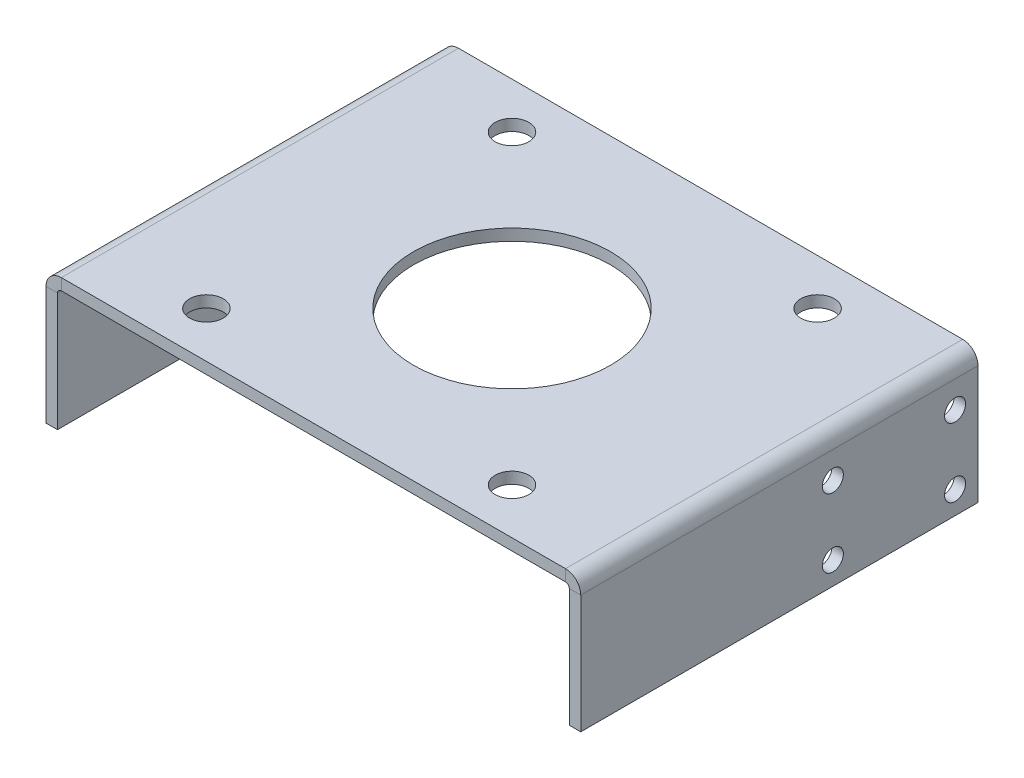
from build123d import *

# Parameters (mm, degrees)
SM_BASE_FLANGE_1_DEPTH = 104
SKETCH_7_R             = 2.75
CUT_EXTRUDE_3_DEPTH    = 3
SKETCH_8_R             = 25.78
CUT_EXTRUDE_4_DEPTH    = 3
SKETCH_9_R             = 4.4
CUT_EXTRUDE_5_DEPTH    = 3


# Sheet-metal steps are written as plain solids
with BuildPart() as part:
    # Sketch 1 → 基体-法兰1 (new body)
    with BuildSketch(Plane.XY):
        with BuildLine():
            Line((-70, -35), (-70, -4))
            ThreePointArc((-70, -4), (-68.828427125, -1.171572875), (-66, 0))
            Line((-66, 0), (66, 0))
            ThreePointArc((66, 0), (68.828427125, -1.171572875), (70, -4))
            Line((70, -4), (70, -35))
            Line((70, -35), (67, -35))
            Line((67, -35), (67, -4))
            ThreePointArc((67, -4), (66.707106781, -3.292893219), (66, -3))
            Line((66, -3), (-66, -3))
            ThreePointArc((-66, -3), (-66.707106781, -3.292893219), (-67, -4))
            Line((-67, -4), (-67, -35))
            Line((-67, -35), (-70, -35))
        make_face()
    extrude(amount=SM_BASE_FLANGE_1_DEPTH)

    # 草图7 → 切除-拉伸3 (cut)
    with BuildSketch(Plane.ZY.offset(70)):
        with Locations(Location((38, -29, 0), (0, 0, 270))):
            Circle(SKETCH_7_R)
        with Locations(Location((38, -11, 0), (0, 0, 270))):
            Circle(SKETCH_7_R)
        with Locations(Location((6, -11, 0), (0, 0, 270))):
            Circle(SKETCH_7_R)
        with Locations(Location((6, -29, 0), (0, 0, 270))):
            Circle(SKETCH_7_R)
    cut_extrude_3 = extrude(amount=-CUT_EXTRUDE_3_DEPTH, mode=Mode.SUBTRACT)

    # 镜向2: 切除-拉伸3 across plane
    add(cut_extrude_3.mirror(Plane(origin=(0, 0, 0), x_dir=(0, 0, 1), z_dir=(1, 0, 0))), mode=Mode.SUBTRACT)

    # 草图8 → 切除-拉伸4 (cut)
    with BuildSketch(Plane(origin=(0, 0, 0), x_dir=(1, 0, 0), z_dir=(0, 1, 0))):
        with Locations(Location((0, -52, 0), (0, 0, 270))):
            Circle(SKETCH_8_R)
    extrude(amount=-CUT_EXTRUDE_4_DEPTH, mode=Mode.SUBTRACT)

    # 草图9 → 切除-拉伸5 (cut)
    with BuildSketch(Plane(origin=(0, 0, 0), x_dir=(1, 0, 0), z_dir=(0, 1, 0))):
        with Locations(Location((-40, -12, 0), (0, 0, 270))):
            Circle(SKETCH_9_R)
        with Locations(Location((40, -12, 0), (0, 0, 270))):
            Circle(SKETCH_9_R)
        with Locations(Location((-40, -92, 0), (0, 0, 270))):
            Circle(SKETCH_9_R)
        with Locations(Location((40, -92, 0), (0, 0, 270))):
            Circle(SKETCH_9_R)
    extrude(amount=-CUT_EXTRUDE_5_DEPTH, mode=Mode.SUBTRACT)


solid = part.part
